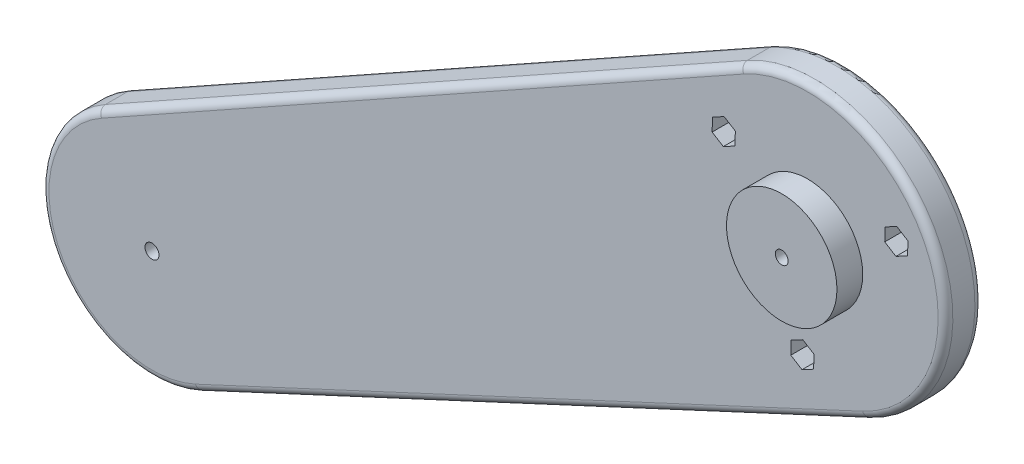
from build123d import *

# Parameters (mm, degrees)
BOSS_EXTRUDE1_DEPTH = 10
FILLET1_R           = 2
CUT_EXTRUDE8_DEPTH  = 5
CUT_EXTRUDE9_START  = -70
SKETCH10_R          = 1.75
CUT_EXTRUDE9_DEPTH  = 71
CIRPATTERN1_COUNT   = 3
SKETCH12_R          = 15
BOSS_EXTRUDE2_DEPTH = 7
CUT_EXTRUDE11_DEPTH = 5
SKETCH15_R          = 1.9
CUT_EXTRUDE12_DEPTH = 5
SKETCH16_R          = 1.75
CUT_EXTRUDE13_DEPTH = 18


with BuildPart() as part:
    # Sketch1 → Boss-Extrude1 (new body)
    with BuildSketch(Plane.XY):
        with BuildLine():
            Line((-192.723621419, -64.866060055), (-18.311266157, 32.725334708))
            ThreePointArc((-18.311266157, 32.725334708), (33.388989093, 17.071186467), (15.807091975, -34.005673693))
            Line((15.807091975, -34.005673693), (-165.428934914, -118.250866776))
            ThreePointArc((-165.428934914, -118.250866776), (-204.785799768, -104.703276995), (-192.723621419, -64.866060055))
        make_face()
    extrude(amount=BOSS_EXTRUDE1_DEPTH)

    # Fillet1
    fillet1_edges = [part.edges().sort_by_distance(p)[0] for p in [
        (33.388989093, 17.071186467, 10),
        (-74.81092147, -76.128270234, 10),
        (-204.785799768, -104.703276995, 10),
        (-105.517443788, -16.070362674, 10),
        (-74.81092147, -76.128270234, 0),
        (33.388989093, 17.071186467, 0),
        (-105.517443788, -16.070362674, 0),
        (-204.785799768, -104.703276995, 0),
    ]]
    fillet(fillet1_edges, radius=FILLET1_R)

    # Sketch3 → Cut-Extrude8 (cut)
    with BuildSketch(Plane.XY.offset(10)):
        Polygon((-4.424109202, -25.18892785), (-4.53581637, -28.767184619), (-1.492808691, -30.65305425), (1.661906157, -28.96066711), (1.773613325, -25.382410341), (-1.269394354, -23.496540711), align=None)
        Polygon((27.292728029, 14.033716876), (24.249720349, 15.919586506), (21.095005502, 14.227199366), (20.983298334, 10.648942597), (24.026306013, 8.763072967), (27.181020861, 10.455460106), align=None)
        Polygon((-19.602196811, 16.425854883), (-22.645204491, 18.311724513), (-25.799919338, 16.619337374), (-25.911626506, 13.041080604), (-22.868618827, 11.155210974), (-19.713903979, 12.847598114), align=None)
    extrude(amount=-CUT_EXTRUDE8_DEPTH, mode=Mode.SUBTRACT)

    # Sketch10 → Cut-Extrude9 (cut)
    with BuildSketch(Plane.XY.offset(5).offset(CUT_EXTRUDE9_START)):
        with Locations((24.040072147, 12.291254256)):
            Circle(SKETCH10_R)
    cut_extrude9 = extrude(amount=CUT_EXTRUDE9_DEPTH, mode=Mode.SUBTRACT)

    # CirPattern1: Cut-Extrude9 ×3 about axis
    cirpattern1_axis = Axis((0, 0, 10), (0, 0, -1))
    for i in range(1, CIRPATTERN1_COUNT):
        add(cut_extrude9.rotate(cirpattern1_axis, i * 360 / CIRPATTERN1_COUNT), mode=Mode.SUBTRACT)

    # Sketch12 → Boss-Extrude2 (add)
    with BuildSketch(Plane.XY.offset(10)):
        Circle(SKETCH12_R)
    extrude(amount=BOSS_EXTRUDE2_DEPTH)

    # Sketch14 → Cut-Extrude11 (cut)
    with BuildSketch(Plane(origin=(0, 0, 0), x_dir=(-1, 0, 0), z_dir=(0, 0, -1))):
        Polygon((179.864608494, -94.146698767), (181.654608494, -91.046327822), (179.864608494, -87.945956876), (176.284608494, -87.945956876), (175.310532611, -89.633105796), (174.494608494, -91.046327822), (176.284608494, -94.146698767), align=None)
    extrude(amount=-CUT_EXTRUDE11_DEPTH, mode=Mode.SUBTRACT)

    # Sketch15 → Cut-Extrude12 (cut)
    with BuildSketch(Plane(origin=(0, 0, 5), x_dir=(-1, 0, 0), z_dir=(0, 0, -1))):
        with Locations((178.074608494, -91.046327822)):
            Circle(SKETCH15_R)
    extrude(amount=-CUT_EXTRUDE12_DEPTH, mode=Mode.SUBTRACT)

    # Sketch16 → Cut-Extrude13 (cut)
    with BuildSketch(Plane(origin=(0, 0, 0), x_dir=(-1, 0, 0), z_dir=(0, 0, -1))):
        Circle(SKETCH16_R)
    extrude(amount=-CUT_EXTRUDE13_DEPTH, mode=Mode.SUBTRACT)


solid = part.part
